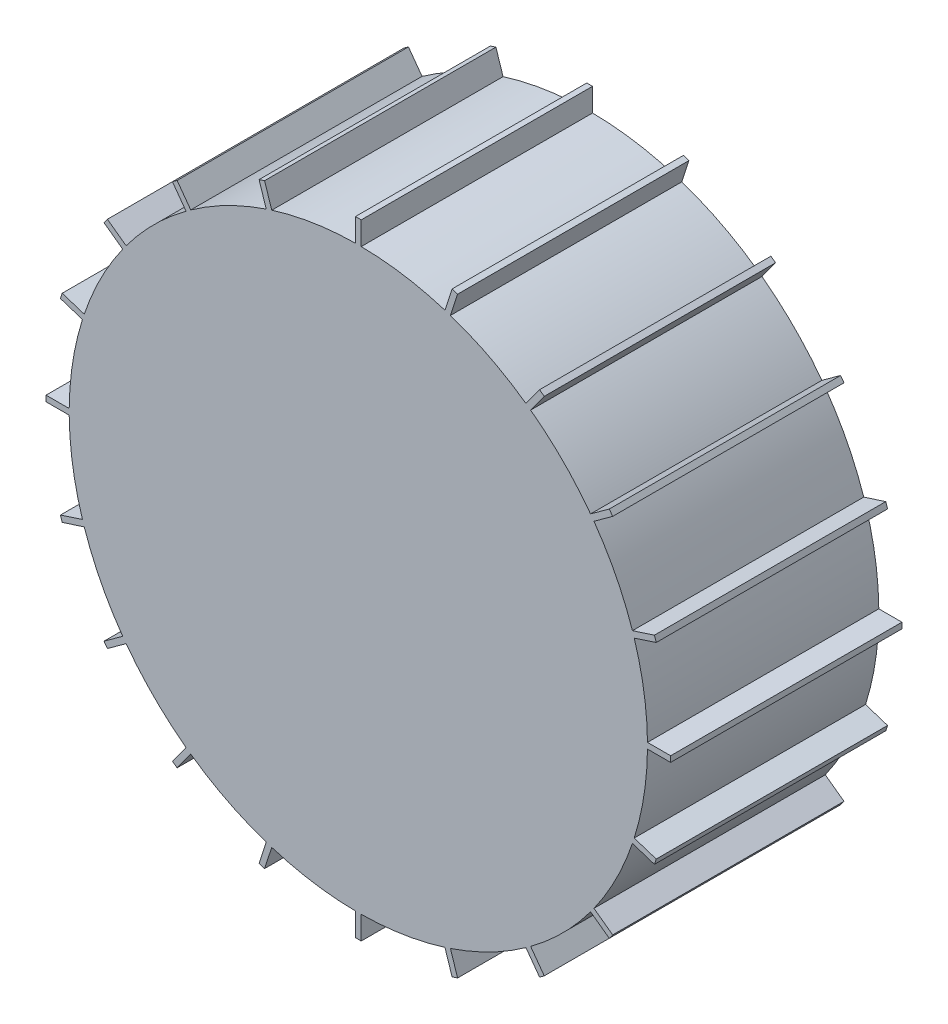
from build123d import *

# Parameters (mm, degrees)
SKETCH1_R        = 250
WHEEL_BASE_DEPTH = 200
SKETCH3_W        = 5
SKETCH3_H        = 200
GROUSER_DEPTH    = 270
GROUSERS_COUNT   = 20


with BuildPart() as part:
    # Sketch1 → Wheel Base (new body)
    with BuildSketch(Plane.XY):
        Circle(SKETCH1_R)
    extrude(amount=WHEEL_BASE_DEPTH)

    # Sketch3 → Grouser (add)
    with BuildSketch(Plane(origin=(0, 0, 0), x_dir=(1, 0, 0), z_dir=(0, 1, 0))):
        with Locations((0, -100)):
            Rectangle(SKETCH3_W, SKETCH3_H)
    grouser = extrude(amount=GROUSER_DEPTH)

    # Grousers: Grouser ×20 about axis
    grousers_axis = Axis((0, 0, 200), (0, 0, -1))
    for i in range(1, GROUSERS_COUNT):
        add(grouser.rotate(grousers_axis, i * 360 / GROUSERS_COUNT))


solid = part.part
